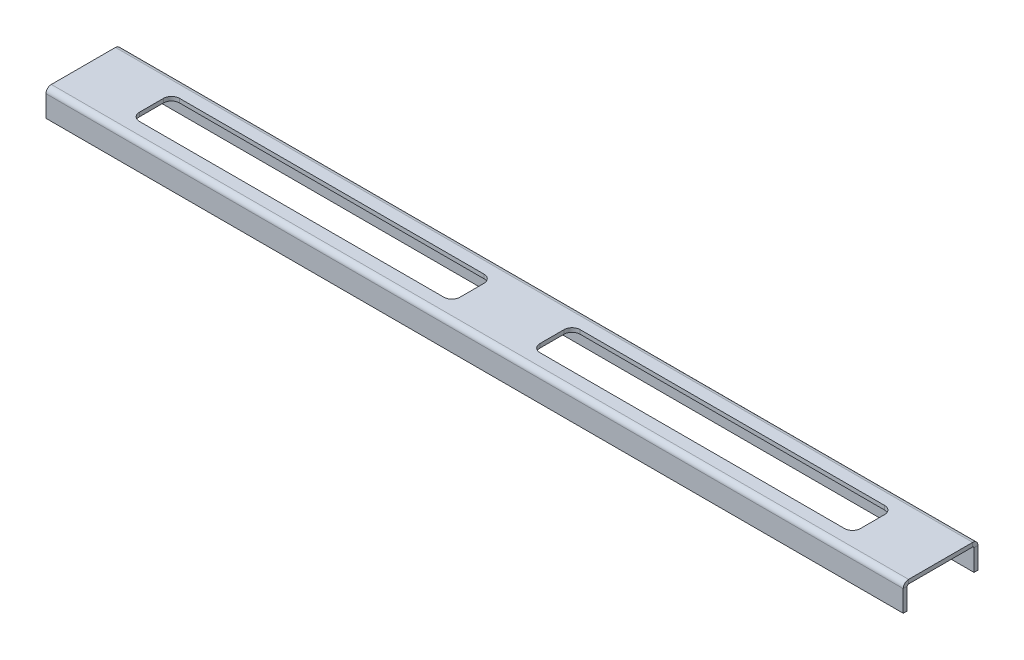
from build123d import *

# Parameters (mm, degrees)
SKETCH_1_W                         = 321
SKETCH_1_H                         = 60
SM_BASE_FLANGE_1_DEPTH             = 1.5
SM_EDGE_FLANGE_1_STRIP_W           = 7
SM_EDGE_FLANGE_1_STRIP_H           = 1.5
SM_EDGE_FLANGE_1_STRIP_CUT_DEPTH   = 321
SM_EDGE_FLANGE_1_STRIP_2_W         = 7
SM_EDGE_FLANGE_1_STRIP_2_H         = 1.5
SM_EDGE_FLANGE_1_STRIP_CUT_2_DEPTH = 321
SM_EDGE_FLANGE_1_DEPTH             = 321
SM_EDGE_FLANGE_1_BEND_DEPTH        = 321
SM_EDGE_FLANGE_2_STRIP_W           = 7
SM_EDGE_FLANGE_2_STRIP_H           = 1.5
SM_EDGE_FLANGE_2_STRIP_CUT_DEPTH   = 321
SM_EDGE_FLANGE_2_STRIP_2_W         = 7
SM_EDGE_FLANGE_2_STRIP_2_H         = 1.5
SM_EDGE_FLANGE_2_STRIP_CUT_2_DEPTH = 321
SM_EDGE_FLANGE_2_DEPTH             = 321
SM_EDGE_FLANGE_2_BEND_DEPTH        = 321
CUT_EXTRUDE_2_DEPTH                = 174.385408844
CUT_EXTRUDE_3_DEPTH                = 57
CUT_EXTRUDE_3_DEPTH_BACK           = 10
SKETCH_20_W                        = 341.087454661
SKETCH_20_H                        = 74.910603127


# Sheet-metal steps are written as plain solids
with BuildPart() as part:
    # Sketch 1 → 基体-法兰1 (new body)
    with BuildSketch(Plane.XY):
        Rectangle(SKETCH_1_W, SKETCH_1_H)
    extrude(amount=-SM_BASE_FLANGE_1_DEPTH)

    # 边线-法兰1 strip (across the edge) → 边线-法兰1 strip cut (cut)
    with BuildSketch(Plane(origin=(160.5, 30, 0), x_dir=(0, -1, 0), z_dir=(-1, 0, 0))):
        with Locations((-1.5, -0.75)):
            Rectangle(SM_EDGE_FLANGE_1_STRIP_W, SM_EDGE_FLANGE_1_STRIP_H)
    extrude(amount=SM_EDGE_FLANGE_1_STRIP_CUT_DEPTH, mode=Mode.SUBTRACT)

    # 边线-法兰1 strip 2 (across the edge) → 边线-法兰1 strip cut 2 (cut)
    with BuildSketch(Plane(origin=(-160.5, -30, 0), x_dir=(0, 1, 0), z_dir=(1, 0, 0))):
        with Locations((-1.5, -0.75)):
            Rectangle(SM_EDGE_FLANGE_1_STRIP_2_W, SM_EDGE_FLANGE_1_STRIP_2_H)
    extrude(amount=SM_EDGE_FLANGE_1_STRIP_CUT_2_DEPTH, mode=Mode.SUBTRACT)

    # 边线-法兰1 section (across the edge) → 边线-法兰1 (add)
    with BuildSketch(Plane(origin=(160.5, 30, 0), x_dir=(0, -1, 0), z_dir=(-1, 0, 0))):
        with BuildLine():
            Line((0, 0.5), (0, 26.5))
            Line((0, 26.5), (1.5, 26.5))
            Line((1.5, 26.5), (1.5, 0.5))
            ThreePointArc((1.5, 0.5), (1.646446609, 0.146446609), (2, 0))
            Line((2, 0), (2, -1.5))
            ThreePointArc((2, -1.5), (0.585786438, -0.914213562), (0, 0.5))
        make_face()
    extrude(amount=SM_EDGE_FLANGE_1_DEPTH)

    # 边线-法兰1 section 2 (across the edge) → 边线-法兰1 bend (add)
    with BuildSketch(Plane(origin=(-160.5, -30, 0), x_dir=(0, 1, 0), z_dir=(1, 0, 0))):
        with BuildLine():
            Line((0, 0.5), (0, 26.5))
            Line((0, 26.5), (1.5, 26.5))
            Line((1.5, 26.5), (1.5, 0.5))
            ThreePointArc((1.5, 0.5), (1.646446609, 0.146446609), (2, 0))
            Line((2, 0), (2, -1.5))
            ThreePointArc((2, -1.5), (0.585786438, -0.914213562), (0, 0.5))
        make_face()
    extrude(amount=SM_EDGE_FLANGE_1_BEND_DEPTH)

    # 边线-法兰2 strip (across the edge) → 边线-法兰2 strip cut (cut)
    with BuildSketch(Plane(origin=(160.5, 28.5, 26.5), x_dir=(0, 0, -1), z_dir=(-1, 0, 0))):
        with Locations((-1.5, -0.75)):
            Rectangle(SM_EDGE_FLANGE_2_STRIP_W, SM_EDGE_FLANGE_2_STRIP_H)
    extrude(amount=SM_EDGE_FLANGE_2_STRIP_CUT_DEPTH, mode=Mode.SUBTRACT)

    # 边线-法兰2 strip 2 (across the edge) → 边线-法兰2 strip cut 2 (cut)
    with BuildSketch(Plane(origin=(-160.5, -28.5, 26.5), x_dir=(0, 0, -1), z_dir=(1, 0, 0))):
        with Locations((-1.5, -0.75)):
            Rectangle(SM_EDGE_FLANGE_2_STRIP_2_W, SM_EDGE_FLANGE_2_STRIP_2_H)
    extrude(amount=SM_EDGE_FLANGE_2_STRIP_CUT_2_DEPTH, mode=Mode.SUBTRACT)

    # 边线-法兰2 section (across the edge) → 边线-法兰2 (add)
    with BuildSketch(Plane(origin=(160.5, 28.5, 26.5), x_dir=(0, 0, -1), z_dir=(-1, 0, 0))):
        with BuildLine():
            Line((0, 0.5), (0, 8.5))
            Line((0, 8.5), (1.5, 8.5))
            Line((1.5, 8.5), (1.5, 0.5))
            ThreePointArc((1.5, 0.5), (1.646446609, 0.146446609), (2, 0))
            Line((2, 0), (2, -1.5))
            ThreePointArc((2, -1.5), (0.585786438, -0.914213562), (0, 0.5))
        make_face()
    extrude(amount=SM_EDGE_FLANGE_2_DEPTH)

    # 边线-法兰2 section 2 (across the edge) → 边线-法兰2 bend (add)
    with BuildSketch(Plane(origin=(-160.5, -28.5, 26.5), x_dir=(0, 0, -1), z_dir=(1, 0, 0))):
        with BuildLine():
            Line((0, 0.5), (0, 8.5))
            Line((0, 8.5), (1.5, 8.5))
            Line((1.5, 8.5), (1.5, 0.5))
            ThreePointArc((1.5, 0.5), (1.646446609, 0.146446609), (2, 0))
            Line((2, 0), (2, -1.5))
            ThreePointArc((2, -1.5), (0.585786438, -0.914213562), (0, 0.5))
        make_face()
    extrude(amount=SM_EDGE_FLANGE_2_BEND_DEPTH)

    # 草图19 → 切除-拉伸2 (cut, through all)
    with BuildSketch(Plane(origin=(0, 30, 0), x_dir=(1, 0, 0), z_dir=(0, 1, 0))):
        with BuildLine():
            Line((-132, -5), (-18, -5))
            ThreePointArc((-18, -5), (-15.878679656, -5.878679656), (-15, -8))
            Line((-15, -8), (-15, -17))
            ThreePointArc((-15, -17), (-15.878679656, -19.121320344), (-18, -20))
            Line((-18, -20), (-132, -20))
            ThreePointArc((-132, -20), (-134.121320344, -19.121320344), (-135, -17))
            Line((-135, -17), (-135, -8))
            ThreePointArc((-135, -8), (-134.121320344, -5.878679656), (-132, -5))
        make_face()
    cut_extrude_2 = extrude(amount=-CUT_EXTRUDE_2_DEPTH, mode=Mode.SUBTRACT)

    # 镜向1: 切除-拉伸2 across plane
    add(cut_extrude_2.mirror(Plane(origin=(0, 0, 0), x_dir=(0, 0, 1), z_dir=(1, 0, 0))), mode=Mode.SUBTRACT)

    # 草图20 → 切除-拉伸3 (cut, two sides: drawn at the far end of the back side and taken through both)
    with BuildSketch(Plane.XY.offset(-CUT_EXTRUDE_3_DEPTH_BACK)):
        with Locations((-10.043727331, -17.455301564)):
            Rectangle(SKETCH_20_W, SKETCH_20_H)
    extrude(amount=CUT_EXTRUDE_3_DEPTH + CUT_EXTRUDE_3_DEPTH_BACK, mode=Mode.SUBTRACT)


solid = part.part
